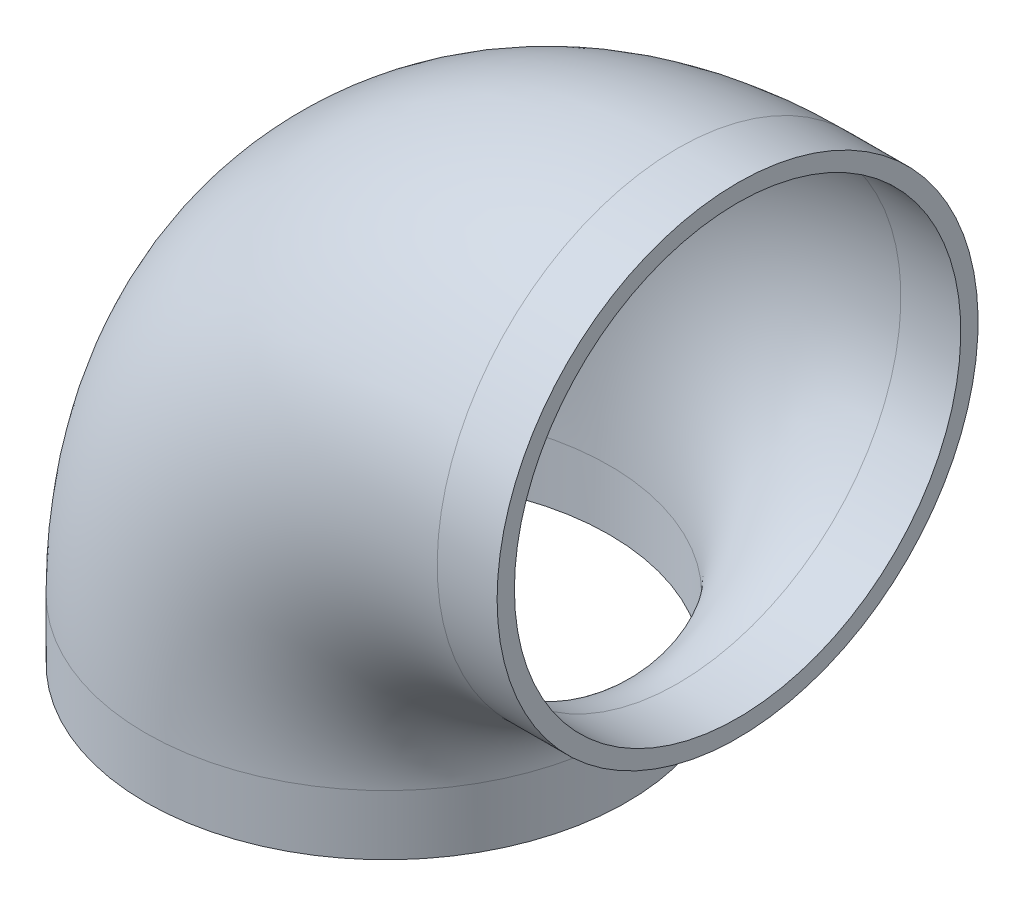
from build123d import *

# Parameters (mm, degrees)
CROQUIS3_R   = 109.474
CROQUIS3_R_2 = 101.6


with BuildPart() as part:
    # Barrer1: sweep along a path in Croquis2
    with BuildLine(Plane.XY) as barrer1_path:
        Line((0, 0), (0, 27.27))
        ThreePointArc((0, 27.27), (38.875716933, 121.124283067), (132.73, 160))
        Line((132.73, 160), (160, 160))
    # Croquis3 → Barrer1 (sweep)
    with BuildSketch(Plane(origin=(0, 0, 0), x_dir=(1, 0, 0), z_dir=(0, 1, 0))):
        Circle(CROQUIS3_R)
        Circle(CROQUIS3_R_2, mode=Mode.SUBTRACT)
    sweep(path=barrer1_path.line)


solid = part.part
